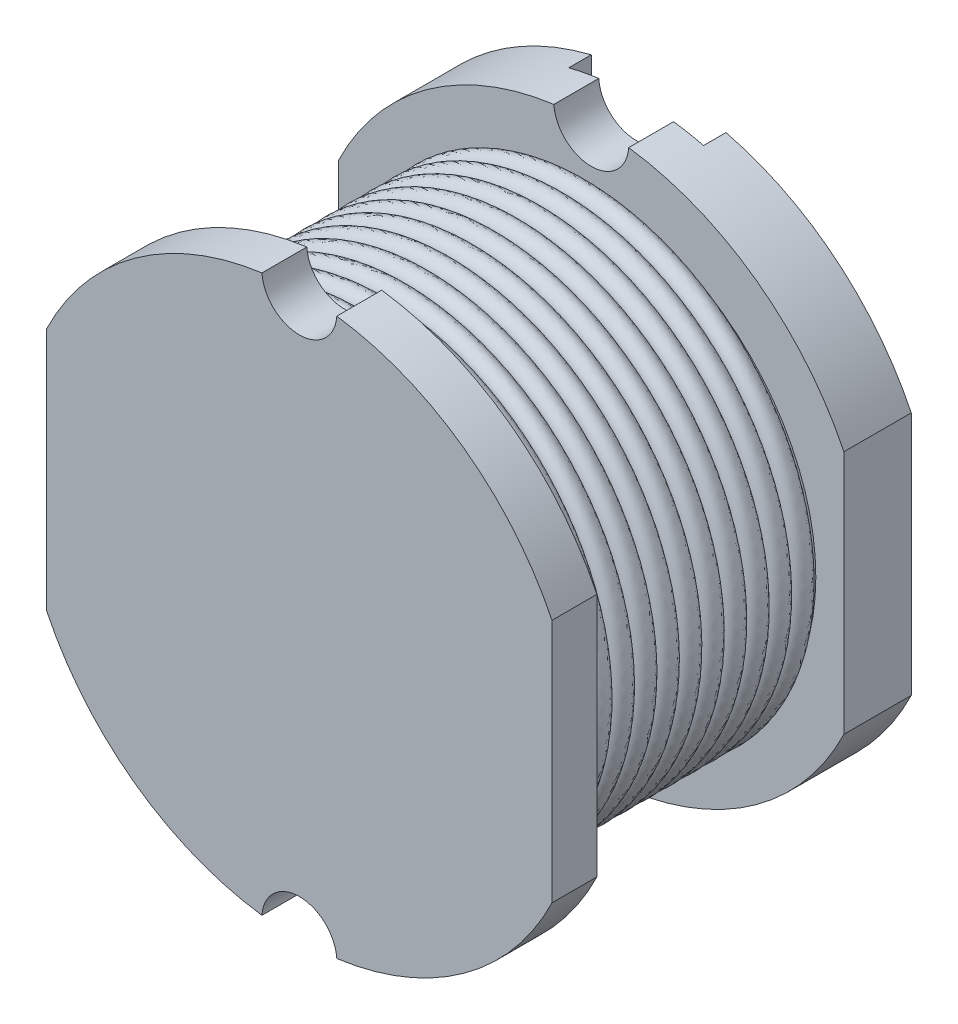
from build123d import *

# Parameters (mm, degrees)
SKETCH1_R               = 2.5
BOSS_EXTRUDE1_DEPTH     = 3.2
SKETCH2_R               = 0.334148007
SKETCH2_W               = 1.24777792
SKETCH2_H               = 5.72284461
CUT_EXTRUDE1_DEPTH      = 5.768647607
SKETCH3_W               = 1.2
SKETCH3_H               = 5
CUT_EXTRUDE2_DEPTH      = 0.2
CUT_EXTRUDE3_DEPTH      = 1.2
CUT_EXTRUDE3_DEPTH_BACK = 1
SKETCH5_R               = 3.020284792
SKETCH5_R_2             = 2
SWEEP8_PITCH            = 0.2


with BuildPart() as part:
    # Sketch1 → Boss-Extrude1 (new body)
    with BuildSketch(Plane.XY):
        Circle(SKETCH1_R)
    extrude(amount=BOSS_EXTRUDE1_DEPTH)

    # Sketch2 → Cut-Extrude1 (cut, through all)
    with BuildSketch(Plane(origin=(0, 0, 0), x_dir=(-1, 0, 0), z_dir=(0, 0, -1))):
        with Locations((0, 2.5)):
            Circle(SKETCH2_R)
        with Locations((0, -2.5)):
            Circle(SKETCH2_R)
        with Locations((-2.87388896, 0)):
            Rectangle(SKETCH2_W, SKETCH2_H)
        with Locations((2.87388896, 0)):
            Rectangle(SKETCH2_W, SKETCH2_H)
    extrude(amount=-CUT_EXTRUDE1_DEPTH, mode=Mode.SUBTRACT)

    # Sketch3 → Cut-Extrude2 (cut)
    with BuildSketch(Plane(origin=(0, 0, 0), x_dir=(-1, 0, 0), z_dir=(0, 0, -1))):
        Rectangle(SKETCH3_W, SKETCH3_H)
    extrude(amount=-CUT_EXTRUDE2_DEPTH, mode=Mode.SUBTRACT)

    # Sketch5 → Cut-Extrude3 (cut, two sides: drawn at the far end of the back side and taken through both)
    with BuildSketch(Plane.XY.offset(1.6).offset(-CUT_EXTRUDE3_DEPTH_BACK)):
        Circle(SKETCH5_R)
        Circle(SKETCH5_R_2, mode=Mode.SUBTRACT)
    extrude(amount=CUT_EXTRUDE3_DEPTH + CUT_EXTRUDE3_DEPTH_BACK, mode=Mode.SUBTRACT)

    # Sweep8: the profile of Sketch28 screwed along a left-hand helix of 11.5 turns, 6 arcs to a turn; built about Z, then put on its axis
    sweep8_z = Axis((0, 0, 0), (0, 0, 1))
    sweep8_corners = [(2, 0, -0.095410606), (1.904589394, 0, 0), (2, 0, 0.095410606), (2.095410606, 0, 0)]
    with BuildLine(mode=Mode.PRIVATE) as sweep8_profile:
        ThreePointArc((2, 0, -0.095410606), (1.932534513, 0, -0.067465487), (1.904589394, 0, 0))
        ThreePointArc((1.904589394, 0, 0), (1.932534513, 0, 0.067465487), (2, 0, 0.095410606))
        ThreePointArc((2, 0, 0.095410606), (2.067465487, 0, 0.067465487), (2.095410606, 0, 0))
        ThreePointArc((2.095410606, 0, 0), (2.067465487, 0, -0.067465487), (2, 0, -0.095410606))
    sweep8_cap = Face(sweep8_profile.wire())
    sweep8_arcs = [((2, 0, -0.095410606), (1.904589394, 0, -0.095410606), (1.904589394, 0, 0), (1, 0.7071067811865475, 1)), ((1.904589394, 0, 0), (1.904589394, 0, 0.095410606), (2, 0, 0.095410606), (1, 0.7071067811865475, 1)), ((2, 0, 0.095410606), (2.095410606, 0, 0.095410606), (2.095410606, 0, 0), (1, 0.7071067811865475, 1)), ((2.095410606, 0, 0), (2.095410606, 0, -0.095410606), (2, 0, -0.095410606), (1, 0.7071067811865475, 1))]  # start, shoulder, end, weights
    sweep8_turn_angles = [0, -30, -60, -90, -120, -150, -180, -210, -240, -270, -300, -330, -360]
    sweep8_turn_weights = [1, 0.8660254037844387, 1, 0.8660254037844387, 1, 0.8660254037844387, 1, 0.8660254037844387, 1, 0.8660254037844387, 1, 0.8660254037844387, 1]
    sweep8_turn_sides = [Face.make_bezier_surface([[Vector(p[j][0], p[j][1], 0).rotate(sweep8_z, sweep8_turn_angles[2 * i + k]) / sweep8_turn_weights[2 * i + k] + Vector(0, 0, p[j][2] + -SWEEP8_PITCH * sweep8_turn_angles[2 * i + k] / 360) for k in range(3)] for j in range(3)], [[p[3][j] * sweep8_turn_weights[2 * i + k] for k in range(3)] for j in range(3)]) for p in sweep8_arcs for i in range(6)]
    sweep8_last_angles = [-3960, -3990, -4020, -4050, -4080, -4110, -4140]
    sweep8_last_weights = [1, 0.8660254037844387, 1, 0.8660254037844387, 1, 0.866025403784407, 1]
    sweep8_last_sides = [Face.make_bezier_surface([[Vector(p[j][0], p[j][1], 0).rotate(sweep8_z, sweep8_last_angles[2 * i + k]) / sweep8_last_weights[2 * i + k] + Vector(0, 0, p[j][2] + -SWEEP8_PITCH * sweep8_last_angles[2 * i + k] / 360) for k in range(3)] for j in range(3)], [[p[3][j] * sweep8_last_weights[2 * i + k] for k in range(3)] for j in range(3)]) for p in sweep8_arcs for i in range(3)]
    sweep8 = Plane(origin=(0, 0, 0.6), x_dir=(0, -1, 0), z_dir=(0, 0, 1)) * Solid(Shell([*[p.moved(Location((0, 0, SWEEP8_PITCH * i))) for i in range(11) for p in sweep8_turn_sides], *sweep8_last_sides, sweep8_cap, sweep8_cap.rotate(sweep8_z, -4140).moved(Location((0, 0, -SWEEP8_PITCH * -4140 / 360)))]))
    add(sweep8)


solid = part.part
